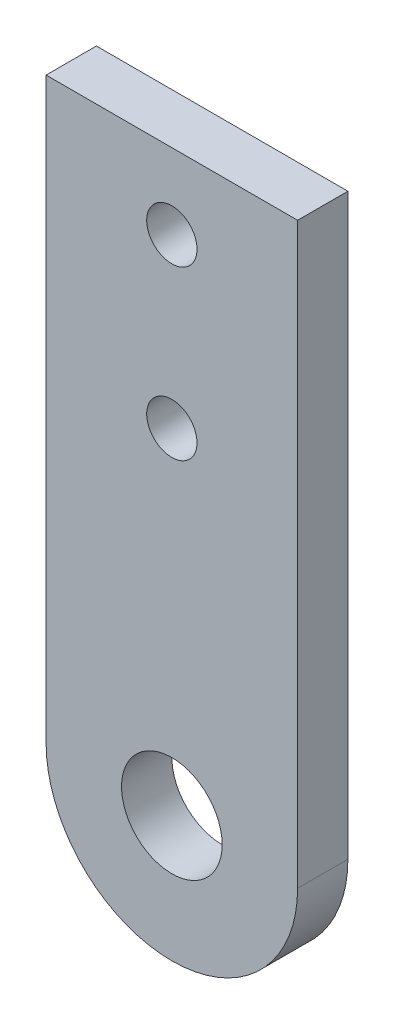
from build123d import *

# Parameters (mm, degrees)
SKETCH_1_W          = 15
SKETCH_1_H          = 42
EXTRUDE_1_DEPTH     = 3
SKETCH_3_R          = 1.5
SKETCH_3_R_2        = 3
CUT_EXTRUDE_1_DEPTH = 23.5
FILLET_1_R          = 7.5


with BuildPart() as part:
    # 草图1 → 凸台-拉伸1 (new body)
    with BuildSketch(Plane.XY):
        Rectangle(SKETCH_1_W, SKETCH_1_H)
    extrude(amount=EXTRUDE_1_DEPTH)

    # 草图3 → 切除-拉伸1 (cut, through all)
    with BuildSketch(Plane.XY.offset(3)):
        with Locations((0, 16.5)):
            Circle(SKETCH_3_R)
        with Locations((0, 6.5)):
            Circle(SKETCH_3_R)
        with Locations((0, -13.5)):
            Circle(SKETCH_3_R_2)
    extrude(amount=-CUT_EXTRUDE_1_DEPTH, mode=Mode.SUBTRACT)

    # 圆角1
    fillet_1_edges = [part.edges().sort_by_distance(p)[0] for p in [
        (-7.5, -21, 1.5),
        (7.5, -21, 1.5),
    ]]
    fillet(fillet_1_edges, radius=FILLET_1_R - 0.0001)  # a hair under: the kernel refuses the full size


solid = part.part
